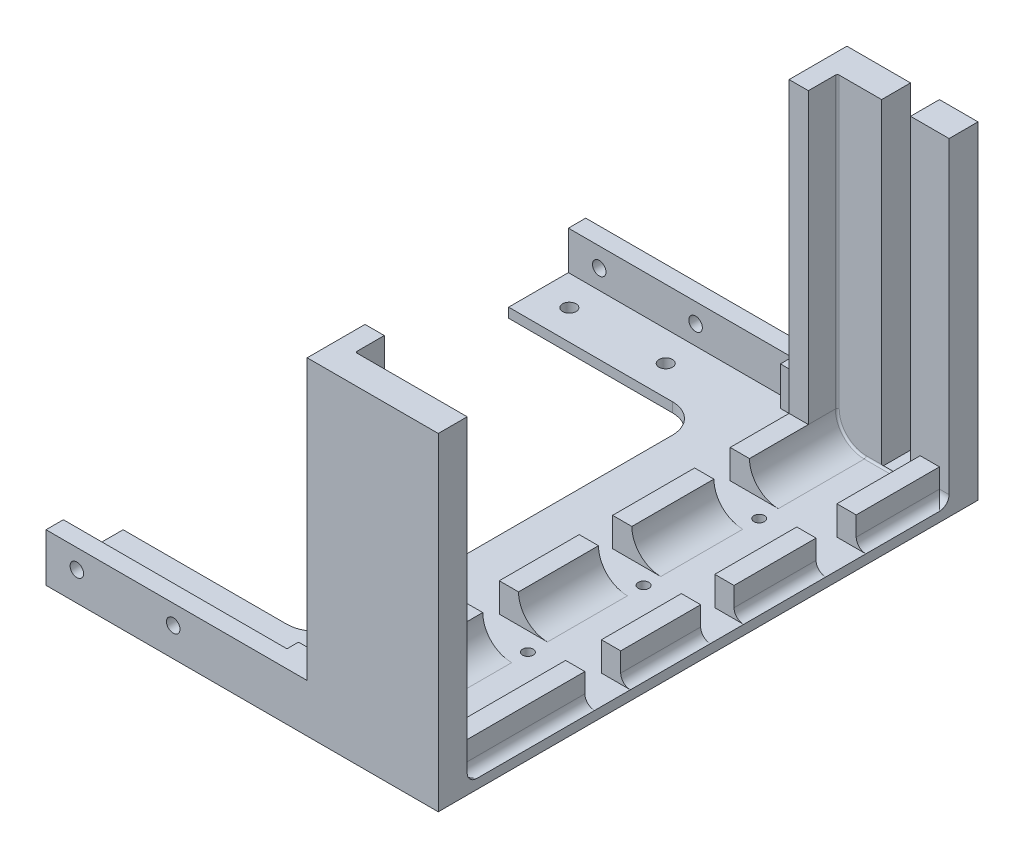
from build123d import *

# Parameters (mm, degrees)
BOSS_EXTRUDE1_DEPTH      = 250
BOSS_EXTRUDE2_DEPTH      = 50
BOSS_EXTRUDE2_2_DEPTH    = 50
LPATTERN1_COUNT          = 4
LPATTERN1_PITCH          = 60
SKETCH2_R                = 2.75
CUT_EXTRUDE1_DEPTH       = 251.864711302
UPPER_ACRYLIC_SUPP_W     = 20
UPPER_ACRYLIC_SUPP_H     = 250
BOSS_EXTRUDE3_DEPTH      = 5
UPPER_ACRYLIC_SUPP_3_W   = 10
UPPER_ACRYLIC_SUPP_3_H   = 66.073604859
UPPER_ACRYLIC_SUPP_3_H_2 = 41.475217291
UPPER_ACRYLIC_SUPP_3_H_3 = 42.557179481
UPPER_ACRYLIC_SUPP_3_H_4 = 45.558340935
BOSS_EXTRUDE4_DEPTH      = 15
FILLET1_R                = 15
SKETCH4_W                = 60
SKETCH4_H                = 15
BOSS_EXTRUDE5_DEPTH      = 5
SKETCH4_3_W              = 60
SKETCH4_3_H              = 15
BOSS_EXTRUDE6_DEPTH      = 60
SKETCH5_W                = 10
SKETCH5_H                = 45
BOSS_EXTRUDE7_DEPTH      = 15
BOSS_EXTRUDE8_START      = 250
SKETCH5_3_W              = 10
SKETCH5_3_H              = 45
BOSS_EXTRUDE8_DEPTH      = 15
FILLET2_R                = 1
SKETCH6_W                = 6
SKETCH6_H                = 60
CUT_EXTRUDE2_DEPTH       = 6
BOSS_EXTRUDE9_DEPTH      = 30
SKETCH8_W                = 333.602701612
SKETCH8_H                = 59.031331047
CUT_EXTRUDE3_DEPTH       = 150
SKETCH9_W                = 6
SKETCH9_H                = 20
CLOTH_ESCAPE_GAP_DEPTH   = 20
SKETCH11_W               = 9
SKETCH11_H               = 20
BOSS_EXTRUDE11_DEPTH     = 100
CUT_EXTRUDE4_DEPTH       = 68
SKETCH13_W               = 40
SKETCH13_H               = 5
BOSS_EXTRUDE13_DEPTH     = 100
CUT_EXTRUDE5_DEPTH       = 100
FILLET3_R                = 15
BOSS_EXTRUDE14_START     = -5
BOSS_EXTRUDE14_DEPTH     = 25
CUT_EXTRUDE6_DEPTH       = 30
CUT_EXTRUDE6_DEPTH_BACK  = 10
SKETCH16_5_W             = 8.5
SKETCH16_5_H             = 41.475217291
SKETCH16_5_H_2           = 42.557179481
SKETCH16_5_W_2           = 1.5
SKETCH16_5_H_3           = 42.177819043
SKETCH16_5_H_4           = 20.831100018
SKETCH16_5_H_5           = 17.311395043
SKETCH16_5_H_6           = 18.573684265
SKETCH16_5_H_7           = 65.073604859
SKETCH16_6_W             = 8.5
SKETCH16_6_H             = 41.475217291
SKETCH16_6_H_2           = 42.557179481
SKETCH16_6_W_2           = 1.5
SKETCH16_6_H_3           = 42.177819043
SKETCH16_6_H_4           = 20.831100018
SKETCH16_6_H_5           = 17.311395043
SKETCH16_6_H_6           = 18.573684265
SKETCH16_6_H_7           = 65.073604859
BOSS_EXTRUDE15_DEPTH     = 5
BOSS_EXTRUDE16_DEPTH     = 20
SKETCH16_8_W             = 8.5
SKETCH16_8_H             = 41.475217291
SKETCH16_8_H_2           = 42.557179481
SKETCH16_8_W_2           = 1.5
SKETCH16_8_H_3           = 42.177819043
SKETCH16_8_H_4           = 65.073604859
BOSS_EXTRUDE17_DEPTH     = 15
BOSS_EXTRUDE18_START     = -5
BOSS_EXTRUDE18_DEPTH     = 25
FILLET4_R                = 5
BOSS_EXTRUDE21_START     = 145
BOSS_EXTRUDE21_DEPTH     = 170
SKETCH19_R               = 3.5
CUT_EXTRUDE7_DEPTH       = 10
CUT_EXTRUDE8_DEPTH       = 355
CUT_EXTRUDE8_DEPTH_BACK  = 10
SKETCH20_R               = 3.5
SKETCH21_W               = 15
SKETCH21_H               = 197.501027769
CUT_EXTRUDE9_DEPTH       = 130


with BuildPart() as part:
    # profile → Boss-Extrude1 (new body)
    with BuildSketch(Plane.XY):
        Polygon((-14.746446609, 10.353553391), (-5.253553391, 10.353553391), (5.667330529, 10.353553391), (14.746446609, 10.353553391), (20, 10.353553391), (20, 15.353553391), (-20, 15.353553391), (-20, 10.353553391), align=None)
    extrude(amount=BOSS_EXTRUDE1_DEPTH)

    # Sketch2 → Cut-Extrude1 (cut, through all)
    with BuildSketch(Plane.XZ.offset(-10.353553391)):
        with Locations(Location((-10, 175, 0), (0, 0, 270))):
            Circle(SKETCH2_R)
        with Locations(Location((10, 175, 0), (0, 0, 270))):
            Circle(SKETCH2_R)
        with Locations(Location((-10, 115, 0), (0, 0, 270))):
            Circle(SKETCH2_R)
        with Locations(Location((10, 115, 0), (0, 0, 270))):
            Circle(SKETCH2_R)
        with Locations(Location((-10, 55, 0), (0, 0, 270))):
            Circle(SKETCH2_R)
        with Locations(Location((10, 55, 0), (0, 0, 270))):
            Circle(SKETCH2_R)
    extrude(amount=-CUT_EXTRUDE1_DEPTH, mode=Mode.SUBTRACT)

    # upper_acrylic_supp → Boss-Extrude3 (add)
    with BuildSketch(Plane(origin=(0, 15.353553391, 0), x_dir=(1, 0, 0), z_dir=(0, 1, 0))):
        with Locations((-30, -125)):
            Rectangle(UPPER_ACRYLIC_SUPP_W, UPPER_ACRYLIC_SUPP_H)
    extrude(amount=-BOSS_EXTRUDE3_DEPTH)

    # upper_acrylic_supp<3> → Boss-Extrude4 (add)
    with BuildSketch(Plane(origin=(0, 15.353553391, 0), x_dir=(1, 0, 0), z_dir=(0, 1, 0))):
        with Locations((-29.5, -216.963197571)):
            Rectangle(UPPER_ACRYLIC_SUPP_3_W, UPPER_ACRYLIC_SUPP_3_H)
        with Locations((-29.5, -144.615102231)):
            Rectangle(UPPER_ACRYLIC_SUPP_3_W, UPPER_ACRYLIC_SUPP_3_H_2)
        with Locations((-29.5, -85.287508801)):
            Rectangle(UPPER_ACRYLIC_SUPP_3_W, UPPER_ACRYLIC_SUPP_3_H_3)
        with Locations((-29.5, -22.779170468)):
            Rectangle(UPPER_ACRYLIC_SUPP_3_W, UPPER_ACRYLIC_SUPP_3_H_4)
    extrude(amount=BOSS_EXTRUDE4_DEPTH)

    # Fillet1
    fillet1_edges = [part.edges().sort_by_distance(p)[0] for p in [
        (-24.5, 15.353553391, 22.779170467),
        (-24.5, 15.353553391, 85.287508801),
        (-24.5, 15.353553391, 144.615102231),
        (-24.5, 15.353553391, 216.963197571),
    ]]
    fillet(fillet1_edges, radius=FILLET1_R - 0.0001)  # a hair under: the kernel refuses the full size



with BuildPart() as body_2:
    # Sketch1<3> → Boss-Extrude2 (new body)
    with BuildSketch(Plane.XY):
        Polygon((-7.253553391, 8.353553391), (-8.119669914, 7.487436867), (-5.5, 7.487436867), (-4.987436867, 7.487436867), (-5.5, 6.974873734), (-7.874873734, 4.6), (-12.125126266, 4.6), (-14.5, 6.974873734), (-15.012563133, 7.487436867), (-14.5, 7.487436867), (-11.880330086, 7.487436867), (-12.746446609, 8.353553391), (-14.746446609, 10.353553391), (-5.253553391, 10.353553391), align=None)
    boss_extrude2 = extrude(amount=BOSS_EXTRUDE2_DEPTH)


with BuildPart() as body_3:
    # Sketch1<3> → Boss-Extrude2 2 (new body)
    with BuildSketch(Plane.XY):
        Polygon((12.746446609, 8.353553391), (11.880330086, 7.487436867), (14.5, 7.487436867), (15.012563133, 7.487436867), (14.5, 6.974873734), (12.125126266, 4.6), (7.874873734, 4.6), (5.5, 6.974873734), (4.987436867, 7.487436867), (5.5, 7.487436867), (8.533447053, 7.487436867), (7.667330529, 8.353553391), (5.667330529, 10.353553391), (14.746446609, 10.353553391), align=None)
    boss_extrude2_2 = extrude(amount=BOSS_EXTRUDE2_2_DEPTH)


with BuildPart() as lpattern1_1:
    # LPattern1: Boss-Extrude2, Boss-Extrude2 2 ×4
    with Locations(*[(0, 0, i * LPATTERN1_PITCH) for i in range(1, LPATTERN1_COUNT)]):
        add(boss_extrude2)
        add(boss_extrude2_2)


with BuildPart() as part_1:
    add(part.part)

    add(body_2.part)  # Boss-Extrude5 merges body 2

    add(body_3.part)  # Boss-Extrude5 merges body 3
    # Sketch4 → Boss-Extrude5 (add, symmetric)
    with BuildSketch(Plane(origin=(0, 15.353553391, 0), x_dir=(1, 0, 0), z_dir=(0, 1, 0))):
        with Locations((-10, -257.5)):
            Rectangle(SKETCH4_W, SKETCH4_H)
        with Locations((-10, 7.5)):
            Rectangle(SKETCH4_W, SKETCH4_H)
    extrude(amount=BOSS_EXTRUDE5_DEPTH, both=True)

    # Sketch4<3> → Boss-Extrude6 (add)
    with BuildSketch(Plane(origin=(0, 15.353553391, 0), x_dir=(1, 0, 0), z_dir=(0, 1, 0))):
        with Locations((-10, -257.5)):
            Rectangle(SKETCH4_3_W, SKETCH4_3_H)
        with Locations((-10, 7.5)):
            Rectangle(SKETCH4_3_W, SKETCH4_3_H)
    extrude(amount=BOSS_EXTRUDE6_DEPTH)

    # Sketch5 → Boss-Extrude7 (add)
    with BuildSketch(Plane(origin=(0, 0, 250), x_dir=(-1, 0, 0), z_dir=(0, 0, -1))):
        with Locations((29.5, 52.853553391)):
            Rectangle(SKETCH5_W, SKETCH5_H)
    extrude(amount=BOSS_EXTRUDE7_DEPTH)

    # Sketch5<3> → Boss-Extrude8 (add)
    with BuildSketch(Plane(origin=(0, 0, 250), x_dir=(-1, 0, 0), z_dir=(0, 0, -1)).offset(BOSS_EXTRUDE8_START)):
        with Locations((29.5, 52.853553391)):
            Rectangle(SKETCH5_3_W, SKETCH5_3_H)
    extrude(amount=-BOSS_EXTRUDE8_DEPTH)

    # Fillet2
    fillet2_edges = [part_1.edges().sort_by_distance(p)[0] for p in [
        (-24.5, 52.853503391, 250),
        (-24.5, 52.853503391, 0),
        (5.24995, 15.353553391, 250),
        (-20.106631007, 19.746922384, 250),
        (-20.106631007, 19.746922384, 0),
        (5.24995, 15.353553391, 0),
    ]]
    fillet(fillet2_edges, radius=FILLET2_R)

    # Sketch6 → Cut-Extrude2 (cut)
    with BuildSketch(Plane.ZY.offset(40)):
        with Locations((253, 45.353553391)):
            Rectangle(SKETCH6_W, SKETCH6_H)
        with Locations((-3, 45.353553391)):
            Rectangle(SKETCH6_W, SKETCH6_H)
    extrude(amount=-CUT_EXTRUDE2_DEPTH, mode=Mode.SUBTRACT)

    # Sketch7 → Boss-Extrude9 (add)
    with BuildSketch(Plane.ZY.offset(40)):
        Polygon((265, 75.353553391), (256, 75.353553391), (256, 15.353553391), (-6, 15.353553391), (-6, 75.353553391), (-15, 75.353553391), (-15, 10.353553391), (265, 10.353553391), align=None)
    extrude(amount=BOSS_EXTRUDE9_DEPTH)

    # Sketch8 → Cut-Extrude3 (cut)
    with BuildSketch(Plane.ZY.offset(70)):
        with Locations((122.426839416, 64.869218915)):
            Rectangle(SKETCH8_W, SKETCH8_H)
    extrude(amount=-CUT_EXTRUDE3_DEPTH, mode=Mode.SUBTRACT)

    # Sketch9 → cloth_escape_gap (add)
    with BuildSketch(Plane.ZY.offset(34)):
        with Locations((253, 25.353553391)):
            Rectangle(SKETCH9_W, SKETCH9_H)
        with Locations((-3, 25.353553391)):
            Rectangle(SKETCH9_W, SKETCH9_H)
    extrude(amount=CLOTH_ESCAPE_GAP_DEPTH)

    # Sketch11 → Boss-Extrude11 (add)
    with BuildSketch(Plane.ZY.offset(70)):
        with Locations((-10.5, 25.353553391)):
            Rectangle(SKETCH11_W, SKETCH11_H)
        with Locations((260.5, 25.353553391)):
            Rectangle(SKETCH11_W, SKETCH11_H)
    extrude(amount=BOSS_EXTRUDE11_DEPTH)

    # Sketch12 → Cut-Extrude4 (cut)
    with BuildSketch(Plane.XZ.offset(-10.353553391)):
        Polygon((-170, 265), (-70, 265), (-170, 260.5), align=None)
        Polygon((-70, -15), (-170, -10.5), (-170, -15), align=None)
    extrude(amount=-CUT_EXTRUDE4_DEPTH, mode=Mode.SUBTRACT)

    # Sketch13 → Boss-Extrude13 (add)
    with BuildSketch(Plane.ZY.offset(70)):
        with Locations((5, 12.853553391)):
            Rectangle(SKETCH13_W, SKETCH13_H)
        with Locations((245, 12.853553391)):
            Rectangle(SKETCH13_W, SKETCH13_H)
    extrude(amount=BOSS_EXTRUDE13_DEPTH)

    # Sketch14 → Cut-Extrude5 (cut)
    with BuildSketch(Plane(origin=(0, 15.353553391, 0), x_dir=(1, 0, 0), z_dir=(0, 1, 0))):
        Polygon((-70, -265), (-170, -260.5), (-170, -265), align=None)
        Polygon((-170, 15), (-170, 10.5), (-70, 15), align=None)
    extrude(amount=-CUT_EXTRUDE5_DEPTH, mode=Mode.SUBTRACT)

    # Fillet3
    fillet3_edges = [part_1.edges().sort_by_distance(p)[0] for p in [
        (-70, 12.853553391, 25),
        (-70, 12.853553391, 225),
    ]]
    fillet(fillet3_edges, radius=FILLET3_R)

    # Sketch16 → Boss-Extrude14 (add)
    with BuildSketch(Plane(origin=(0, 15.353553391, 0), x_dir=(1, 0, 0), z_dir=(0, 1, 0)).offset(BOSS_EXTRUDE14_START)):
        Polygon((28.5, 0), (33.5, 0), (33.5, 15), (18.5, 15), (18.5, 0), align=None)
        Polygon((18.5, -250), (18.5, -265), (33.5, -265), (33.5, -250), (28.5, -250), align=None)
    extrude(amount=BOSS_EXTRUDE14_DEPTH)

    # Sketch16<5> → Cut-Extrude6 (cut, two sides: drawn at the far end of the back side and taken through both)
    with BuildSketch(Plane(origin=(0, 15.353553391, 0), x_dir=(1, 0, 0), z_dir=(0, 1, 0)).offset(-CUT_EXTRUDE6_DEPTH_BACK)):
        Polygon((18.5, -250), (18.5, -265), (33.5, -265), (33.5, -250), (28.5, -250), align=None)
        Polygon((28.5, -250), (33.5, -250), (33.5, 0), (28.5, 0), (28.5, -43.177819043), (20, -43.177819043), (20, -64.008919061), (28.5, -64.008919061), (28.5, -106.566098542), (20, -106.566098542), (20, -123.877493585), (28.5, -123.877493585), (28.5, -165.352710876), (20, -165.352710876), (20, -183.926395141), (28.5, -183.926395141), align=None)
        with Locations((24.25, -144.615102231)):
            Rectangle(SKETCH16_5_W, SKETCH16_5_H)
        with Locations((24.25, -85.287508801)):
            Rectangle(SKETCH16_5_W, SKETCH16_5_H_2)
        Polygon((28.5, -43.177819043), (28.5, 0), (18.5, 0), (18.5, -1), (20, -1), (20, -43.177819043), align=None)
        Polygon((28.5, 0), (33.5, 0), (33.5, 15), (18.5, 15), (18.5, 0), align=None)
        with Locations((19.25, -22.088909521)):
            Rectangle(SKETCH16_5_W_2, SKETCH16_5_H_3)
        with Locations((19.25, -53.593369052)):
            Rectangle(SKETCH16_5_W_2, SKETCH16_5_H_4)
        with Locations((19.25, -85.287508801)):
            Rectangle(SKETCH16_5_W_2, SKETCH16_5_H_2)
        with Locations((19.25, -115.221796064)):
            Rectangle(SKETCH16_5_W_2, SKETCH16_5_H_5)
        with Locations((19.25, -144.615102231)):
            Rectangle(SKETCH16_5_W_2, SKETCH16_5_H)
        with Locations((19.25, -174.639553009)):
            Rectangle(SKETCH16_5_W_2, SKETCH16_5_H_6)
        with Locations((19.25, -216.463197571)):
            Rectangle(SKETCH16_5_W_2, SKETCH16_5_H_7)
        Polygon((18.5, -249), (18.5, -250), (28.5, -250), (28.5, -183.926395141), (20, -183.926395141), (20, -249), align=None)
    extrude(amount=CUT_EXTRUDE6_DEPTH + CUT_EXTRUDE6_DEPTH_BACK, mode=Mode.SUBTRACT)

    # Sketch16<6> → Boss-Extrude15 (add)
    with BuildSketch(Plane(origin=(0, 15.353553391, 0), x_dir=(1, 0, 0), z_dir=(0, 1, 0))):
        Polygon((28.5, -250), (33.5, -250), (33.5, 0), (28.5, 0), (28.5, -43.177819043), (20, -43.177819043), (20, -64.008919061), (28.5, -64.008919061), (28.5, -106.566098542), (20, -106.566098542), (20, -123.877493585), (28.5, -123.877493585), (28.5, -165.352710876), (20, -165.352710876), (20, -183.926395141), (28.5, -183.926395141), align=None)
        Polygon((18.5, -249), (18.5, -250), (28.5, -250), (28.5, -183.926395141), (20, -183.926395141), (20, -249), align=None)
        Polygon((18.5, -250), (18.5, -265), (33.5, -265), (33.5, -250), (28.5, -250), align=None)
        with Locations((24.25, -144.615102231)):
            Rectangle(SKETCH16_6_W, SKETCH16_6_H)
        with Locations((24.25, -85.287508801)):
            Rectangle(SKETCH16_6_W, SKETCH16_6_H_2)
        Polygon((28.5, -43.177819043), (28.5, 0), (18.5, 0), (18.5, -1), (20, -1), (20, -43.177819043), align=None)
        Polygon((28.5, 0), (33.5, 0), (33.5, 15), (18.5, 15), (18.5, 0), align=None)
        with Locations((19.25, -22.088909521)):
            Rectangle(SKETCH16_6_W_2, SKETCH16_6_H_3)
        with Locations((19.25, -53.593369052)):
            Rectangle(SKETCH16_6_W_2, SKETCH16_6_H_4)
        with Locations((19.25, -85.287508801)):
            Rectangle(SKETCH16_6_W_2, SKETCH16_6_H_2)
        with Locations((19.25, -115.221796064)):
            Rectangle(SKETCH16_6_W_2, SKETCH16_6_H_5)
        with Locations((19.25, -144.615102231)):
            Rectangle(SKETCH16_6_W_2, SKETCH16_6_H)
        with Locations((19.25, -174.639553009)):
            Rectangle(SKETCH16_6_W_2, SKETCH16_6_H_6)
        with Locations((19.25, -216.463197571)):
            Rectangle(SKETCH16_6_W_2, SKETCH16_6_H_7)
    extrude(amount=-BOSS_EXTRUDE15_DEPTH)

    # Sketch16<7> → Boss-Extrude16 (add)
    with BuildSketch(Plane(origin=(0, 15.353553391, 0), x_dir=(1, 0, 0), z_dir=(0, 1, 0))):
        Polygon((18.5, -250), (18.5, -265), (33.5, -265), (33.5, -250), (28.5, -250), align=None)
        Polygon((28.5, 0), (33.5, 0), (33.5, 15), (18.5, 15), (18.5, 0), align=None)
    extrude(amount=BOSS_EXTRUDE16_DEPTH)

    # Sketch16<8> → Boss-Extrude17 (add)
    with BuildSketch(Plane(origin=(0, 15.353553391, 0), x_dir=(1, 0, 0), z_dir=(0, 1, 0))):
        Polygon((18.5, -249), (18.5, -250), (28.5, -250), (28.5, -183.926395141), (20, -183.926395141), (20, -249), align=None)
        with Locations((24.25, -144.615102231)):
            Rectangle(SKETCH16_8_W, SKETCH16_8_H)
        with Locations((24.25, -85.287508801)):
            Rectangle(SKETCH16_8_W, SKETCH16_8_H_2)
        Polygon((28.5, -43.177819043), (28.5, 0), (18.5, 0), (18.5, -1), (20, -1), (20, -43.177819043), align=None)
        with Locations((19.25, -22.088909521)):
            Rectangle(SKETCH16_8_W_2, SKETCH16_8_H_3)
        with Locations((19.25, -85.287508801)):
            Rectangle(SKETCH16_8_W_2, SKETCH16_8_H_2)
        with Locations((19.25, -144.615102231)):
            Rectangle(SKETCH16_8_W_2, SKETCH16_8_H)
        with Locations((19.25, -216.463197571)):
            Rectangle(SKETCH16_8_W_2, SKETCH16_8_H_4)
    extrude(amount=BOSS_EXTRUDE17_DEPTH)

    # Sketch14<2> → Boss-Extrude18 (add)
    with BuildSketch(Plane(origin=(0, 15.353553391, 0), x_dir=(1, 0, 0), z_dir=(0, 1, 0)).offset(BOSS_EXTRUDE18_START)):
        Polygon((-70, -265), (-170, -260.5), (-170, -265), align=None)
        Polygon((-170, 15), (-170, 10.5), (-70, 15), align=None)
    extrude(amount=BOSS_EXTRUDE18_DEPTH)

    # Fillet4
    fillet4_edges = [part_1.edges().sort_by_distance(p)[0] for p in [
        (31, 15.353553391, 0),
        (28.5, 15.353553391, 21.588909521),
        (28.5, 15.353553391, 85.287508801),
        (28.5, 15.353553391, 144.615102231),
        (31, 15.353553391, 250),
        (28.5, 15.353553391, 216.963197571),
    ]]
    fillet(fillet4_edges, radius=FILLET4_R - 0.0001)  # a hair under: the kernel refuses the full size

    # Sketch18 → Boss-Extrude21 (add)
    with BuildSketch(Plane(origin=(0, 35.353553391, 0), x_dir=(1, 0, 0), z_dir=(0, 1, 0)).offset(BOSS_EXTRUDE21_START)):
        with BuildLine():
            Line((-34.5, -250), (-34.5, -265))
            Line((-34.5, -265), (33.5, -265))
            Line((33.5, -265), (33.5, -250))
            Line((33.5, -250), (-23.5, -250))
            ThreePointArc((-23.5, -250), (-24.207106781, -249.707106781), (-24.5, -249))
            Line((-24.5, -249), (-24.5, -235))
            Line((-24.5, -235), (-34.5, -235))
            Line((-34.5, -235), (-34.5, -250))
        make_face()
        with BuildLine():
            Line((-34.5, 15), (-34.5, 0))
            Line((-34.5, 0), (-34.5, -15))
            Line((-34.5, -15), (-24.5, -15))
            Line((-24.5, -15), (-24.5, -1))
            ThreePointArc((-24.5, -1), (-24.207106781, -0.292893219), (-23.5, 0))
            Line((-23.5, 0), (33.5, 0))
            Line((33.5, 0), (33.5, 15))
            Line((33.5, 15), (-34.5, 15))
        make_face()
    extrude(amount=-BOSS_EXTRUDE21_DEPTH)

    # Sketch19 → Cut-Extrude7 (cut)
    with BuildSketch(Plane(origin=(0, 15.353553391, 0), x_dir=(1, 0, 0), z_dir=(0, 1, 0))):
        with Locations(Location((-154, -9.5, 0), (0, 0, 270))):
            Circle(SKETCH19_R)
        with Locations(Location((-104, -9.5, 0), (0, 0, 270))):
            Circle(SKETCH19_R)
        with Locations(Location((-104, -240.5, 0), (0, 0, 270))):
            Circle(SKETCH19_R)
        with Locations(Location((-154, -240.5, 0), (0, 0, 270))):
            Circle(SKETCH19_R)
    extrude(amount=-CUT_EXTRUDE7_DEPTH, mode=Mode.SUBTRACT)

    # Sketch20 → Cut-Extrude8 (cut, two sides: drawn at the far end of the back side and taken through both)
    with BuildSketch(Plane(origin=(0, 0, 256), x_dir=(-1, 0, 0), z_dir=(0, 0, -1)).offset(-CUT_EXTRUDE8_DEPTH_BACK)):
        with Locations(Location((104, 25.353553391, 0), (0, 0, 180))):
            Circle(SKETCH20_R)
        with Locations(Location((154, 25.353553391, 0), (0, 0, 180))):
            Circle(SKETCH20_R)
    extrude(amount=CUT_EXTRUDE8_DEPTH + CUT_EXTRUDE8_DEPTH_BACK, mode=Mode.SUBTRACT)

    # Sketch21 → Cut-Extrude9 (cut)
    with BuildSketch(Plane.XY):
        with Locations((6, 114.104067276)):
            Rectangle(SKETCH21_W, SKETCH21_H)
    extrude(amount=-CUT_EXTRUDE9_DEPTH, mode=Mode.SUBTRACT)


solid = Compound([lpattern1_1.part, part_1.part])
